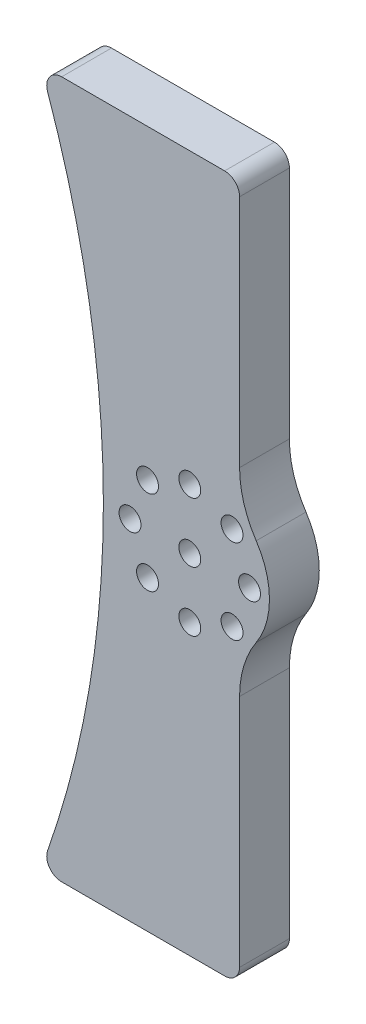
from build123d import *

# Parameters (mm, degrees)
SKETCH_1_R      = 1.1
EXTRUDE_1_DEPTH = 5
EXTRUDE_2_DEPTH = 5
FILLET_1_R      = 1.5


with BuildPart() as part:
    # ｽｹｯﾁ1 → ﾎﾞｽ - 押し出し1 (new body)
    with BuildSketch(Plane.XY):
        with BuildLine():
            Line((-5, 70), (5, 70))
            Line((5, 70), (5, 44.949874371))
            ThreePointArc((5, 44.949874371), (5.425728922, 42.063123025), (6.666666667, 39.422166387))
            ThreePointArc((6.666666667, 39.422166387), (8, 35), (6.666666667, 30.577833613))
            ThreePointArc((6.666666667, 30.577833613), (5.425728922, 27.936876975), (5, 25.050125629))
            Line((5, 25.050125629), (5, 0))
            Line((5, 0), (-5, 0))
            Line((-5, 0), (-5, 25.050125629))
            ThreePointArc((-5, 25.050125629), (-5.425728922, 27.936876975), (-6.666666667, 30.577833613))
            ThreePointArc((-6.666666667, 30.577833613), (-8, 35), (-6.666666667, 39.422166387))
            ThreePointArc((-6.666666667, 39.422166387), (-5.425728922, 42.063123025), (-5, 44.949874371))
            Line((-5, 44.949874371), (-5, 70))
        make_face()
        with Locations((0, 35)):
            Circle(SKETCH_1_R, mode=Mode.SUBTRACT)
        with Locations((0, 29)):
            Circle(SKETCH_1_R, mode=Mode.SUBTRACT)
        with Locations((-4.242640687, 30.757359313)):
            Circle(SKETCH_1_R, mode=Mode.SUBTRACT)
        with Locations((-6, 35)):
            Circle(SKETCH_1_R, mode=Mode.SUBTRACT)
        with Locations((-4.242640687, 39.242640687)):
            Circle(SKETCH_1_R, mode=Mode.SUBTRACT)
        with Locations((0, 41)):
            Circle(SKETCH_1_R, mode=Mode.SUBTRACT)
        with Locations((4.242640687, 39.242640687)):
            Circle(SKETCH_1_R, mode=Mode.SUBTRACT)
        with Locations((6, 35)):
            Circle(SKETCH_1_R, mode=Mode.SUBTRACT)
        with Locations((4.242640687, 30.757359313)):
            Circle(SKETCH_1_R, mode=Mode.SUBTRACT)
    extrude(amount=EXTRUDE_1_DEPTH)

    # ｽｹｯﾁ2 → ﾎﾞｽ - 押し出し2 (add)
    with BuildSketch(Plane(origin=(0, 0, 0), x_dir=(-1, 0, 0), z_dir=(0, 0, -1))):
        with BuildLine():
            Line((5, 25.050125629), (5, 0))
            Line((5, 0), (15, 0))
            ThreePointArc((15, 0), (8.674969976, 35), (15, 70))
            Line((15, 70), (5, 70))
            Line((5, 70), (5, 44.949874371))
            ThreePointArc((5, 44.949874371), (5.425728922, 42.063123025), (6.666666667, 39.422166387))
            ThreePointArc((6.666666667, 39.422166387), (8, 35), (6.666666667, 30.577833613))
            ThreePointArc((6.666666667, 30.577833613), (5.425728922, 27.936876975), (5, 25.050125629))
        make_face()
    extrude(amount=-EXTRUDE_2_DEPTH)

    # ﾌｨﾚｯﾄ1
    fillet_1_edges = [part.edges().sort_by_distance(p)[0] for p in [
        (5, 0, 2.5),
        (-15, 0, 2.5),
        (-15, 70, 2.5),
        (5, 70, 2.5),
    ]]
    fillet(fillet_1_edges, radius=FILLET_1_R)


solid = part.part
